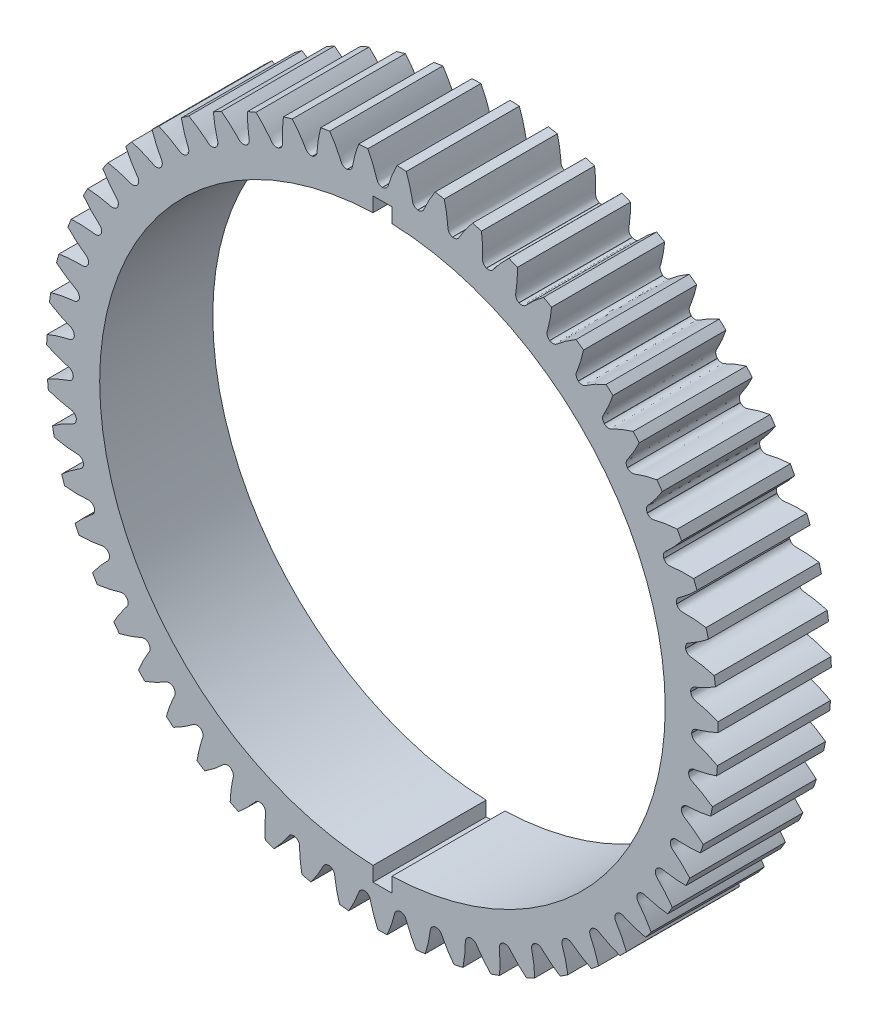
from build123d import *

# Parameters (mm, degrees)
SKETCH_1_R               = 35.625
EXTRUDE_1_DEPTH          = 12
CUT_EXTRUDE_1_DEPTH      = 52.79074483
PATTERN_CIRCULAR_1_COUNT = 55
SKETCH_4_R               = 30
CUT_EXTRUDE_2_DEPTH      = 52.788038567
SKETCH_5_W               = 2
SKETCH_5_H               = 63.05841417
CUT_EXTRUDE_3_DEPTH      = 52.788038567


with BuildPart() as part:
    # 草图1 → 凸台-拉伸1 (new body)
    with BuildSketch(Plane.XY):
        Circle(SKETCH_1_R)
    extrude(amount=EXTRUDE_1_DEPTH)

    # 草图2 → 切除-拉伸1 (cut, through all)
    with BuildSketch(Plane.XY):
        with BuildLine():
            ThreePointArc((0.01, 32.812493891), (0, 32.812495415), (-0.01, 32.812493891))
            add(Edge.make_bspline(
                [(-0.01, 32.812493891), (-0.538556294, 32.884566673), (-0.614014245, 33.29972622), (-0.761546322, 33.756690403), (-0.826658116, 33.948838897), (-0.900278135, 34.151629317), (-0.982501423, 34.365013787), (-1.073883366, 34.588659845), (-1.174834976, 34.822300597), (-1.285799331, 35.065632515), (-1.407199739, 35.31834545), (-1.539454295, 35.580114202), (-1.682971227, 35.850601233), (-1.83814978, 36.12945618), (-2.005379524, 36.416316293), (-2.185040117, 36.710806627), (-2.377500943, 37.01254031), (-2.583120801, 37.3211188), (-2.802247581, 37.63613216), (-3.035217955, 37.957159332), (-3.282357074, 38.283768427), (-3.54397826, 38.615517019), (-3.820382755, 38.951952443), (-4.111859299, 39.29261211), (-4.526689524, 39.758259784), (-4.852778091, 40.10262114), (-5.077568625, 40.330945349)],
                knots=[0, 0, 0, 0, 0.114373893, 0.135076287, 0.157187263, 0.18070682, 0.20563496, 0.231971682, 0.259716986, 0.288870873, 0.319433341, 0.351404391, 0.384784024, 0.419572238, 0.455769035, 0.493374414, 0.532388375, 0.572810918, 0.614642043, 0.65788175, 0.70253004, 0.748586911, 0.796052365, 0.8449264, 0.895209018, 1, 1, 1, 1], degree=3))
            ThreePointArc((-5.077568625, 40.330945349), (0, 40.649315564), (5.077568625, 40.330945349))
            add(Edge.make_bspline(
                [(0.01, 32.812493891), (0.538556294, 32.884566673), (0.614014245, 33.29972622), (0.761546322, 33.756690403), (0.826658116, 33.948838897), (0.900278135, 34.151629317), (0.982501423, 34.365013787), (1.073883366, 34.588659845), (1.174834976, 34.822300597), (1.285799331, 35.065632515), (1.407199739, 35.31834545), (1.539454295, 35.580114202), (1.682971227, 35.850601233), (1.83814978, 36.12945618), (2.005379524, 36.416316293), (2.185040117, 36.710806627), (2.377500943, 37.01254031), (2.583120801, 37.3211188), (2.802247581, 37.63613216), (3.035217955, 37.957159332), (3.282357074, 38.283768427), (3.54397826, 38.615517019), (3.820382755, 38.951952443), (4.111859299, 39.29261211), (4.526689524, 39.758259784), (4.852778091, 40.10262114), (5.077568625, 40.330945349)],
                knots=[0, 0, 0, 0, 0.114373893, 0.135076287, 0.157187263, 0.18070682, 0.20563496, 0.231971682, 0.259716986, 0.288870873, 0.319433341, 0.351404391, 0.384784024, 0.419572238, 0.455769035, 0.493374414, 0.532388375, 0.572810918, 0.614642043, 0.65788175, 0.70253004, 0.748586911, 0.796052365, 0.8449264, 0.895209018, 1, 1, 1, 1], degree=3))
        make_face()
    cut_extrude_1 = extrude(amount=CUT_EXTRUDE_1_DEPTH, mode=Mode.SUBTRACT)

    # 阵列(圆周)1: 切除-拉伸1 ×55 about axis
    pattern_circular_1_axis = Axis((0, 0, -0.6), (0, 0, 1))
    for i in range(1, PATTERN_CIRCULAR_1_COUNT):
        add(cut_extrude_1.rotate(pattern_circular_1_axis, i * 360 / PATTERN_CIRCULAR_1_COUNT), mode=Mode.SUBTRACT)

    # 草图4 → 切除-拉伸2 (cut, through all)
    with BuildSketch(Plane.XY.offset(12)):
        Circle(SKETCH_4_R)
    extrude(amount=-CUT_EXTRUDE_2_DEPTH, mode=Mode.SUBTRACT)

    # 草图5 → 切除-拉伸3 (cut, through all)
    with BuildSketch(Plane.XY.offset(12)):
        Rectangle(SKETCH_5_W, SKETCH_5_H)
    extrude(amount=-CUT_EXTRUDE_3_DEPTH, mode=Mode.SUBTRACT)


solid = part.part
